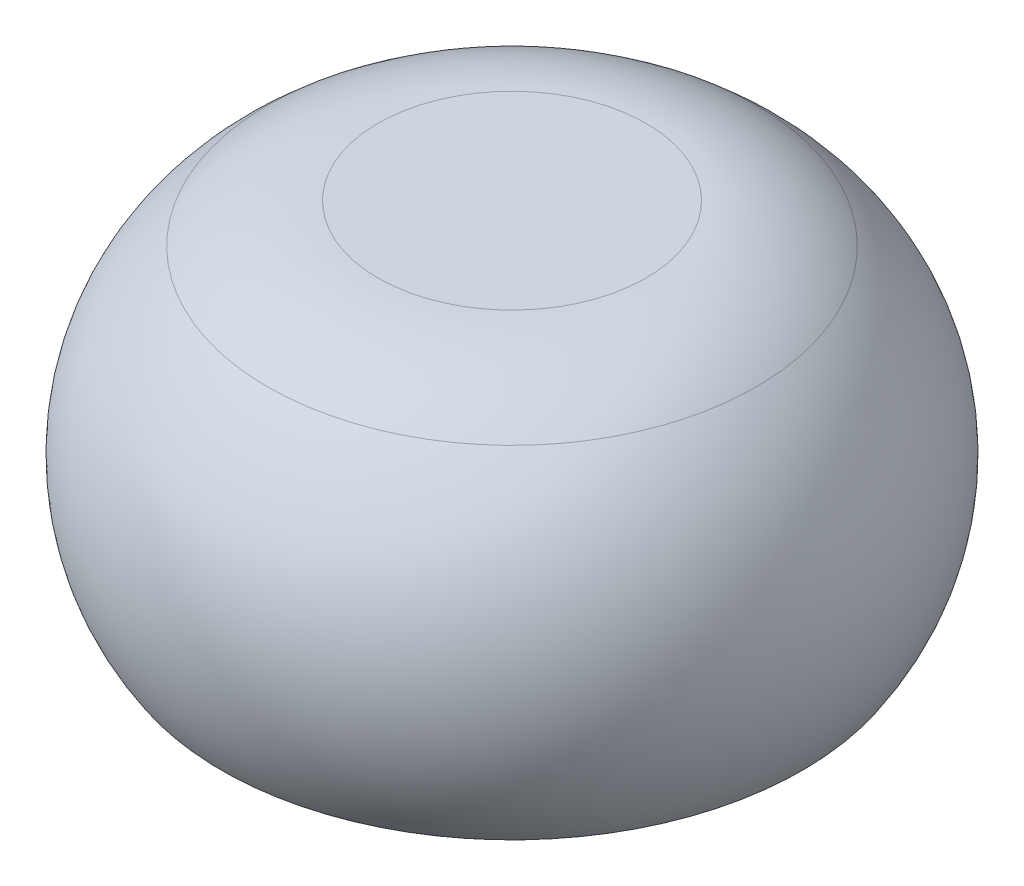
from build123d import *
from build123d.topology import SkipClean

# Parameters (mm, degrees)
SKETCH3_R           = 11
BOSS_EXTRUDE3_DEPTH = 6
BOSS_EXTRUDE3_TAPER = 40
FILLET1_R           = 3
FILLET2_R           = 0.4
SKETCH4_W           = 3.3
SKETCH4_H           = 3.3
CUT_EXTRUDE1_DEPTH  = 4.5
CUT_EXTRUDE2_DEPTH  = 17.07096292
CHAMFER3_SIZE       = 0.2
SKETCH7_R           = 3.2
CUT_EXTRUDE3_DEPTH  = 1
CHAMFER4_SIZE       = 0.2
SKETCH9_R           = 2.6
BOSS_EXTRUDE4_DEPTH = 0.7
FILLET3_R           = 3


# Read off the part's stored shape, not the designer's step: Mirror1
with BuildPart() as part:
    # Sketch3 → Boss-Extrude3 (new body)
    with BuildSketch(Plane(origin=(0, 0, 0), x_dir=(1, 0, 0), z_dir=(0, 1, 0))):
        Circle(SKETCH3_R)
    extrude(amount=BOSS_EXTRUDE3_DEPTH, taper=BOSS_EXTRUDE3_TAPER)

    # Fillet1
    fillet1_edges = [part.edges().sort_by_distance(p)[0] for p in [
        (-5.965402213, 6, 0),
    ]]
    fillet(fillet1_edges, radius=FILLET1_R)

    # Fillet2
    fillet2_edges = [part.edges().sort_by_distance(p)[0] for p in [
        (-11, 0, 0),
    ]]
    fillet(fillet2_edges, radius=FILLET2_R)

    # Sketch4 → Cut-Extrude1 (cut)
    with BuildSketch(Plane.XZ):
        Rectangle(SKETCH4_W, SKETCH4_H)
    extrude(amount=-CUT_EXTRUDE1_DEPTH, mode=Mode.SUBTRACT)

    # Sketch5 → Cut-Extrude2 (cut, through all)
    with BuildSketch(Plane.XZ):
        with BuildLine():
            Line((-13.652715989, 0), (13.652715989, 0))
            ThreePointArc((13.652715989, 0), (0, -15.684261885), (-13.652715989, 0))
        make_face()
    extrude(amount=-CUT_EXTRUDE2_DEPTH, mode=Mode.SUBTRACT)

    # Sketch6 → Cut-Revolve1 (revolve, cut)
    with BuildSketch(Plane(origin=(0, 0, 0), x_dir=(-1, 0, 0), z_dir=(0, 0, -1))):
        with BuildLine():
            Line((-9.420154834, 1.882786153), (-9.16303979, 2.18920393))
            ThreePointArc((-9.16303979, 2.18920393), (-8.275217918, 2.488558757), (-8.134579614, 3.414875039))
            Line((-8.134579614, 3.414875039), (-7.87746457, 3.721292816))
            ThreePointArc((-7.87746457, 3.721292816), (-6.989642699, 4.020647643), (-6.849004395, 4.946963925))
            Line((-6.849004395, 4.946963925), (-6.591889351, 5.253381703))
            ThreePointArc((-6.591889351, 5.253381703), (-5.70406748, 5.552736529), (-5.563429175, 6.479052812))
            Line((-5.563429175, 6.479052812), (-5.306314132, 6.785470589))
            ThreePointArc((-5.306314132, 6.785470589), (-4.41849226, 7.084825416), (-4.277853956, 8.011141698))
            ThreePointArc((-4.277853956, 8.011141698), (-10.583292115, 7.036077543), (-10.448615009, 0.657115044))
            ThreePointArc((-10.448615009, 0.657115044), (-9.560793138, 0.956469871), (-9.420154834, 1.882786153))
        make_face()
    revolve(axis=Axis((0, 0, 0), (0, 1, 0)), mode=Mode.SUBTRACT)

    # Mirror1: part across plane


with BuildPart() as part_1:
    with SkipClean():  # the faces are left unmerged after this step: merging them gives an invalid solid
        add(part.part)
        add(part.part.mirror(Plane(origin=(-13.652715989, 6, 0), x_dir=(1, 0, 0), z_dir=(0, 0, 1))))

    # Chamfer3
    chamfer3_edges = [part_1.edges().sort_by_distance(p)[0] for p in [
        (1.65, 0, 0.825),
        (0, 0, -1.65),
        (-1.65, 0, 0.825),
        (0, 0, 1.65),
    ]]
    chamfer(chamfer3_edges, length=CHAMFER3_SIZE)

    # Sketch7 → Cut-Extrude3 (cut)
    with SkipClean():  # the faces are left unmerged after this step: merging them gives an invalid solid
        with BuildSketch(Plane.XZ):
            with Locations(Location((0, 0, 0), (0, 0, 270))):
                Circle(SKETCH7_R)
        extrude(amount=-CUT_EXTRUDE3_DEPTH, mode=Mode.SUBTRACT)

    # Chamfer4
    chamfer4_edges = [part_1.edges().sort_by_distance(p)[0] for p in [
        (-2.2627417, 0, -2.2627417),
    ]]
    chamfer(chamfer4_edges, length=CHAMFER4_SIZE)

    # Sketch11 → Cut-Revolve2 (revolve, cut)
    with BuildSketch(Plane(origin=(0, 0, 0), x_dir=(0, 0, -1), z_dir=(1, 0, 0)), mode=Mode.PRIVATE) as cut_revolve2_sk:
        with BuildLine():
            ThreePointArc((5, 0), (5.470943184, 3.490314395), (3, 6))
            ThreePointArc((3, 6), (18.910038102, 7.970012701), (5, 0))
        make_face()
    revolve(cut_revolve2_sk.sketch.rotate(Axis((0, 0, 0), (0, 1, 0)), 180), axis=Axis((0, 0, 0), (0, 1, 0)), mode=Mode.SUBTRACT)

    # Fillet3
    fillet3_edges = [part_1.edges().sort_by_distance(p)[0] for p in [
        (0, 6, -3),
    ]]
    fillet(fillet3_edges, radius=FILLET3_R)


with BuildPart() as body_2:
    # Sketch9 → Boss-Extrude4 (new body)
    with BuildSketch(Plane.XZ):
        with Locations(Location((0, 0, 0), (0, 0, 270))):
            Circle(SKETCH9_R)
    extrude(amount=-BOSS_EXTRUDE4_DEPTH)


solid = Compound([part_1.part, body_2.part])
